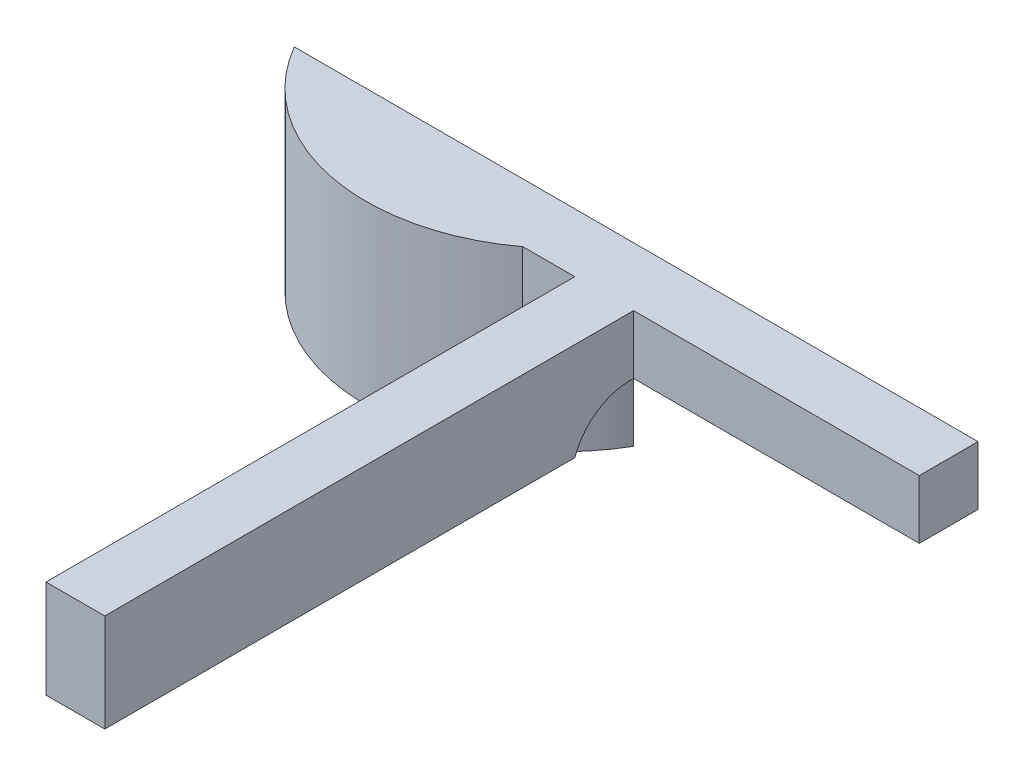
from build123d import *

# Parameters (mm, degrees)
EXTRUDE_1_DEPTH = 3
EXTRUDE_START   = 6
EXTRUDE_2_DEPTH = 6
EXTRUDE_6_DEPTH = 30
FILLET_1_R      = 1
EXTRUDE_9_DEPTH = 24.000000000000007
FILLET_2_R      = 3


with BuildPart() as part:
    # 草图1 → 凸台-拉伸1 (new body)
    with BuildSketch(Plane(origin=(0, 0, 0), x_dir=(1, 0, 0), z_dir=(0, 1, 0))):
        with BuildLine():
            ThreePointArc((-8.660254037844387, -5.000000000000001), (-2.0048037027267505, -9.796977192661679), (5.999999999999981, -8.000000000000014))
            Line((5.999999999999978, -8), (26.244997998398397, -8))
            Line((26.244997998398397, -8), (26.244997998398397, -5))
            Line((26.244997998398397, -5), (-8.660254037844389, -5))
        make_face()
    extrude(amount=EXTRUDE_1_DEPTH)

    # 草图2 → 凸台-拉伸2 (add)
    with BuildSketch(Plane.XZ.offset(EXTRUDE_START)):
        with BuildLine():
            ThreePointArc((6.000000000000001, 7.999999999999999), (-2.0048037027267367, 9.796977192661682), (-8.660254037844386, 5.0000000000000036))
            Line((-8.660254037844387, 5), (-6.244997998398355, 5))
            ThreePointArc((-6.244997998398368, 5.000000000000037), (7.6e-15, 8), (6.244997998398378, 5.000000000000025))
            Line((6.24499799839837, 5), (8.660254037844625, 5))
            ThreePointArc((8.660254037844535, 4.999999999999743), (7.4820292777785, 6.63469953249319), (6.000000000000001, 7.999999999999999))
        make_face()
    extrude(amount=-EXTRUDE_2_DEPTH)

    # 草图3 → 凸台-拉伸6 (add)
    with BuildSketch(Plane(origin=(0, 0, 5), x_dir=(-1, 0, 0), z_dir=(0, 0, -1))):
        Polygon((-8.660254037844387, 0), (-8.660254037844387, 3.000000000000001), (-11.660254037844386, 3), (-11.660254037844384, 0), align=None)
    extrude(amount=-EXTRUDE_6_DEPTH)

    # 圆角1
    fillet_1_edges = [part.edges().sort_by_distance(p)[0] for p in [
        (7.4820292777784605, 0, 6.634699532493231),
    ]]
    fillet(fillet_1_edges, radius=FILLET_1_R)

    # 草图5 → 凸台-拉伸9 (add)
    with BuildSketch(Plane.XY.offset(34.99999999999999)):
        Polygon((8.660254037844387, -2.0027453895176524), (8.660254037844387, 0), (11.660254037844386, 0), (11.660254037844384, -2.002745389517652), align=None)
    extrude(amount=-EXTRUDE_9_DEPTH)

    # 圆角2
    # the kernel refuses this fillet: 3 mm, written as the material it adds along each edge
    with BuildSketch(Plane(origin=(8.660254037844387, 0, 10.999999999999986), x_dir=(0, -1, 0), z_dir=(1, 0, 0))) as fillet_2_piece_1:
        with BuildLine():
            CenterArc((3, 2.8293962680882476), FILLET_2_R, 180, 70.58438351191461)
            Line((0, 2.8293962680882476), (-0.06, 2.8293962680882476))
            Line((-0.06, 2.8293962680882476), (-0.06, 0))
            Line((-0.06, 0), (0, -0.0600000000000005))
            ThreePointArc((0, -0.0600000000000005), (1.0013726947588264, -0.0600000000000005), (1.9828002973080059, -0.05658792536176449))
            Line((1.9828002973080059, -0.05658792536176449), (2.002745389517653, 0))
        make_face()
    extrude(amount=2.9999999999999982)


solid = part.part
